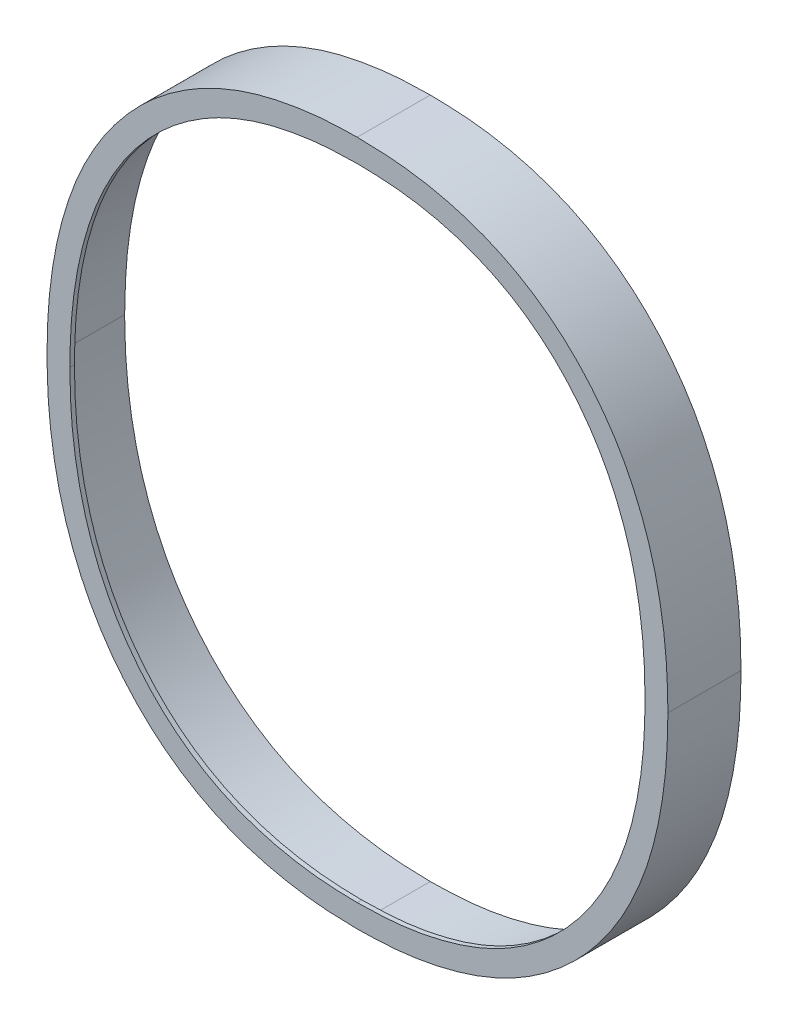
from build123d import *

# Parameters (mm, degrees)
BOSS_EXTRUDE1_DEPTH      = 1
BOSS_EXTRUDE1_DEPTH_BACK = 15
CUT_EXTRUDE1_DEPTH       = 16
CUT_EXTRUDE2_START       = -15
CUT_EXTRUDE2_DEPTH       = 15


# Read off the part's stored shape, not the designer's step: Cut-Extrude2
with BuildPart() as part:
    # Sketch1 → Boss-Extrude1 (new, two sides: drawn at the far end of the back side and taken through both)
    with BuildSketch(Plane.XY.offset(-BOSS_EXTRUDE1_DEPTH_BACK)):
        with BuildLine():
            add(Edge.make_bspline(
                [(2840.630960302, -1649.127227385), (2843.022054701, -1649.073911429), (2845.413070864, -1649.020141783), (2850.156339498, -1648.687812612), (2852.507701403, -1648.404088711), (2857.17163245, -1647.611682455), (2859.48438751, -1647.10407823), (2862.923008979, -1646.165738512), (2864.064167888, -1645.823683921), (2866.335213886, -1645.074209679), (2867.467482799, -1644.665783034), (2870.829320189, -1643.335733796), (2872.994098002, -1642.321572419), (2877.169582805, -1640.036364134), (2879.18055644, -1638.76576181), (2882.086669887, -1636.675874432), (2883.036830192, -1635.94832621), (2884.899039036, -1634.429685211), (2885.812127271, -1633.637143509), (2888.457161209, -1631.195244367), (2890.107907041, -1629.472639652), (2893.198544911, -1625.850164274), (2894.64077414, -1623.952258502), (2896.654506528, -1620.979620669), (2897.300714255, -1619.96572132), (2898.533473545, -1617.896167574), (2899.115012792, -1616.847075064), (2900.215965966, -1614.723363251), (2900.735766668, -1613.648902872), (2901.72322762, -1611.478558024), (2902.191625372, -1610.382976588), (2903.519171278, -1607.064327613), (2904.297122902, -1604.807897076), (2905.299697591, -1601.355720056), (2905.608102842, -1600.191887285), (2906.173438143, -1597.856878958), (2906.430422357, -1596.686400256), (2907.131635422, -1593.166887234), (2907.507657724, -1590.809953543), (2908.100006275, -1586.077590898), (2908.310571262, -1583.7014947), (2908.554703044, -1578.928803185), (2908.59792776, -1576.533326404), (2908.641066386, -1574.137839653)],
                knots=[0, 0, 0, 0, 0.0625, 0.0625, 0.125, 0.125, 0.1875, 0.1875, 0.21875, 0.21875, 0.25, 0.25, 0.3125, 0.3125, 0.375, 0.375, 0.40625, 0.40625, 0.4375, 0.4375, 0.5, 0.5, 0.5625, 0.5625, 0.59375, 0.59375, 0.625, 0.625, 0.65625, 0.65625, 0.6875, 0.6875, 0.75, 0.75, 0.78125, 0.78125, 0.8125, 0.8125, 0.875, 0.875, 0.9375, 0.9375, 1, 1, 1, 1], degree=3))
            add(Edge.make_bspline(
                [(2908.641066386, -1574.137839653), (2908.597684216, -1571.749685108), (2908.554151134, -1569.361554623), (2908.31304406, -1564.609851419), (2908.106187622, -1562.247758542), (2907.524039294, -1557.550425385), (2907.154061898, -1555.21433785), (2906.236986224, -1550.570400039), (2905.689366766, -1548.262632853), (2904.703405489, -1544.827212383), (2904.34705344, -1543.686487989), (2903.572771273, -1541.414856203), (2903.154120858, -1540.28122658), (2902.267440911, -1538.046905836), (2901.798929713, -1536.943851847), (2900.814107957, -1534.764531445), (2900.297125011, -1533.68864185), (2899.205963563, -1531.568916023), (2898.631499938, -1530.525239579), (2897.41827183, -1528.473921989), (2896.780463243, -1527.465745141), (2895.44723529, -1525.481677509), (2894.752132385, -1524.505609373), (2893.30693504, -1522.584291295), (2892.553742764, -1521.636672844), (2890.22908385, -1518.877244276), (2888.588507349, -1517.142626654), (2885.114342522, -1513.896581368), (2883.278682745, -1512.387549034), (2880.384407258, -1510.286798752), (2879.39655034, -1509.613258606), (2877.878323043, -1508.64508814), (2877.366138049, -1508.32942908), (2876.329059108, -1507.712807008), (2875.80430847, -1507.411984926), (2873.167951515, -1505.956972773), (2871.002655235, -1504.941729569), (2866.578185459, -1503.15969733), (2864.318863097, -1502.393302281), (2860.859823361, -1501.429119478), (2859.695172123, -1501.138526167), (2857.343889073, -1500.615513029), (2856.159625817, -1500.383667883), (2852.605335681, -1499.774802839), (2850.224545609, -1499.483953726), (2845.439214375, -1499.144885898), (2843.035197893, -1499.091307285), (2840.631161128, -1499.037935869)],
                knots=[0, 0, 0, 0, 0.0625, 0.0625, 0.125, 0.125, 0.1875, 0.1875, 0.25, 0.25, 0.28125, 0.28125, 0.3125, 0.3125, 0.34375, 0.34375, 0.375, 0.375, 0.40625, 0.40625, 0.4375, 0.4375, 0.46875, 0.46875, 0.5, 0.5, 0.5625, 0.5625, 0.625, 0.625, 0.65625, 0.65625, 0.671875, 0.671875, 0.6875, 0.6875, 0.75, 0.75, 0.8125, 0.8125, 0.84375, 0.84375, 0.875, 0.875, 0.9375, 0.9375, 1, 1, 1, 1], degree=3))
            add(Edge.make_bspline(
                [(2840.631161128, -1499.037935869), (2838.241286886, -1499.086479702), (2835.851511001, -1499.135588626), (2831.114536639, -1499.478424205), (2828.768733045, -1499.780164814), (2824.110163995, -1500.573458304), (2821.79605746, -1501.057306352), (2818.359665055, -1501.982825721), (2817.220189296, -1502.325736879), (2814.95350723, -1503.082050233), (2813.824899226, -1503.495790184), (2810.46632118, -1504.840695188), (2808.301126553, -1505.858894794), (2804.128188688, -1508.154516516), (2802.120056663, -1509.431298547), (2799.216615185, -1511.525524623), (2798.267222719, -1512.253928271), (2796.407727536, -1513.775420847), (2795.495891103, -1514.570885965), (2792.858468041, -1517.025000352), (2791.216352781, -1518.757197413), (2788.13473117, -1522.389237829), (2786.698381425, -1524.291693081), (2784.703140457, -1527.277173293), (2784.064062283, -1528.29406976), (2782.836667762, -1530.36897413), (2782.252855453, -1531.41854421), (2780.590140999, -1534.603230075), (2779.603593752, -1536.775794374), (2777.863858748, -1541.215546719), (2777.102717343, -1543.479509681), (2776.09739876, -1546.930759637), (2775.785661565, -1548.092923268), (2775.213545802, -1550.426597315), (2774.953853796, -1551.596485313), (2774.24713742, -1555.114522529), (2773.870079664, -1557.470768058), (2773.275316744, -1562.201698881), (2773.063582089, -1564.577075064), (2772.817178406, -1569.34831689), (2772.773136252, -1571.743097906), (2772.729177232, -1574.137888542)],
                knots=[0, 0, 0, 0, 0.0625, 0.0625, 0.125, 0.125, 0.1875, 0.1875, 0.21875, 0.21875, 0.25, 0.25, 0.3125, 0.3125, 0.375, 0.375, 0.40625, 0.40625, 0.4375, 0.4375, 0.5, 0.5, 0.5625, 0.5625, 0.59375, 0.59375, 0.625, 0.625, 0.6875, 0.6875, 0.75, 0.75, 0.78125, 0.78125, 0.8125, 0.8125, 0.875, 0.875, 0.9375, 0.9375, 1, 1, 1, 1], degree=3))
            add(Edge.make_bspline(
                [(2772.729177232, -1574.137888542), (2772.772747468, -1576.523465097), (2772.816487881, -1578.909014704), (2773.065140971, -1583.654591906), (2773.27963263, -1586.013102645), (2773.876430246, -1590.703550329), (2774.252288362, -1593.036508304), (2775.186969432, -1597.673451335), (2775.750706452, -1599.976658237), (2776.751690017, -1603.406864106), (2777.110690722, -1604.54625349), (2777.881132057, -1606.816728269), (2778.293463055, -1607.948209098), (2779.169744022, -1610.175841964), (2779.63488391, -1611.27486453), (2780.6231676, -1613.4411274), (2781.145626046, -1614.508743233), (2782.24387675, -1616.614751538), (2782.819383091, -1617.653300675), (2784.022462748, -1619.70186973), (2784.650661408, -1620.711547003), (2785.967013857, -1622.698050149), (2786.655677043, -1623.674596908), (2788.097802587, -1625.592184816), (2788.851733479, -1626.534716288), (2791.173370124, -1629.277267887), (2792.805870322, -1631.009770365), (2796.259699807, -1634.261161576), (2798.084604707, -1635.776005381), (2800.96899379, -1637.881940789), (2801.954858944, -1638.556314245), (2803.976750183, -1639.848316381), (2805.015971223, -1640.467446998), (2808.166723517, -1642.211822033), (2810.322166811, -1643.232142223), (2814.733666299, -1645.011650694), (2816.989789686, -1645.770664582), (2820.444871597, -1646.725178948), (2821.60833047, -1647.012815638), (2823.9566123, -1647.532640419), (2825.137304318, -1647.764036529), (2828.682421032, -1648.379348859), (2831.056658486, -1648.682255112), (2835.831400443, -1649.027729105), (2838.231167417, -1649.077606653), (2840.630960302, -1649.127227385)],
                knots=[0, 0, 0, 0, 0.0625, 0.0625, 0.125, 0.125, 0.1875, 0.1875, 0.25, 0.25, 0.28125, 0.28125, 0.3125, 0.3125, 0.34375, 0.34375, 0.375, 0.375, 0.40625, 0.40625, 0.4375, 0.4375, 0.46875, 0.46875, 0.5, 0.5, 0.5625, 0.5625, 0.625, 0.625, 0.65625, 0.65625, 0.6875, 0.6875, 0.75, 0.75, 0.8125, 0.8125, 0.84375, 0.84375, 0.875, 0.875, 0.9375, 0.9375, 1, 1, 1, 1], degree=3))
        make_face()
    extrude(amount=BOSS_EXTRUDE1_DEPTH + BOSS_EXTRUDE1_DEPTH_BACK)

    # 3DSketch1 → Cut-Extrude1 (cut)
    with BuildSketch(Plane(origin=(2903.64024848, -1574.138232494, 1), x_dir=(-0.9958790258074864, 0.09069159804927863, 0), z_dir=(0, 0, 1))):
        with BuildLine():
            add(Edge.make_bspline(
                [(0, 3e-09), (0.039471166, -0.360736712), (0.078959387, -0.721471667), (0.118578724, -1.082193102), (0.23929524, -2.174442295), (0.363305901, -3.266351786), (0.449232706, -3.997345354), (0.674001133, -5.817906957), (0.933864418, -7.634175942), (1.103425941, -8.719622817), (1.469558725, -10.863739332), (1.901296085, -12.995665319), (2.130480165, -14.047708576), (2.618529373, -16.144466206), (3.163855771, -18.226982814), (3.451389254, -19.263929837), (4.08142225, -21.409935766), (4.781520266, -23.534595226), (5.16504804, -24.630208377), (6.005663316, -26.886792415), (6.945427951, -29.104407137), (7.457907184, -30.242192347), (8.568329988, -32.570284213), (9.780516439, -34.847369375), (10.434904387, -36.007045616), (11.802820967, -38.288467666), (13.297521804, -40.48981886), (14.074919346, -41.568282249), (15.684544635, -43.674053074), (17.409312673, -45.686018074), (18.296666541, -46.664891033), (20.121820381, -48.570230767), (22.048764276, -50.373590103), (23.036444692, -51.245848597), (25.059213736, -52.925212385), (27.185887698, -54.47120835), (28.270858823, -55.209274286), (30.484845009, -56.61877634), (32.77858615, -57.894343291), (33.944580441, -58.496871404), (36.185345756, -59.566812452), (38.487507253, -60.497171835), (39.585112003, -60.90581288), (41.662883705, -61.61753787), (43.770781453, -62.230056464), (44.760726333, -62.494385342), (46.618195239, -62.947410507), (48.492378693, -63.325380219), (49.365404766, -63.484902006), (51.12268797, -63.773609409), (52.888806043, -64.000320328), (53.77668691, -64.099061015), (55.555514648, -64.267775606), (57.338806178, -64.381363567), (58.231300717, -64.423684953), (60.035182959, -64.478536365), (61.839759158, -64.468665362), (62.750922467, -64.449185637), (64.273581376, -64.395745273), (65.79450141, -64.313020594), (66.405435958, -64.276189258), (67.313217101, -64.217804415), (68.220793217, -64.156519061), (68.517713081, -64.136254225), (68.814624653, -64.115872097), (69.111534763, -64.095469272)],
                knots=[0, 0, 0, 0, 0, 0, 0.016988956, 0.016988956, 0.016988956, 0.051445443, 0.051445443, 0.051445443, 0.102863971, 0.102863971, 0.102863971, 0.153256586, 0.153256586, 0.153256586, 0.203620937, 0.203620937, 0.203620937, 0.257940032, 0.257940032, 0.257940032, 0.316317368, 0.316317368, 0.316317368, 0.378603204, 0.378603204, 0.378603204, 0.44077287, 0.44077287, 0.44077287, 0.502567106, 0.502567106, 0.502567106, 0.564181676, 0.564181676, 0.564181676, 0.62553548, 0.62553548, 0.62553548, 0.686901486, 0.686901486, 0.686901486, 0.741666033, 0.741666033, 0.741666033, 0.789610874, 0.789610874, 0.789610874, 0.831139688, 0.831139688, 0.831139688, 0.872948555, 0.872948555, 0.872948555, 0.914761928, 0.914761928, 0.914761928, 0.957414508, 0.957414508, 0.957414508, 0.98606715, 0.98606715, 0.98606715, 1, 1, 1, 1, 1, 1], degree=5))
            add(Edge.make_bspline(
                [(69.111534763, -64.095469272), (69.464795959, -64.056046836), (69.818054441, -64.01659478), (70.171295024, -63.976948012), (71.237710525, -63.856158877), (72.303686195, -63.730584888), (73.016053901, -63.642183331), (74.803994445, -63.403197447), (76.584072904, -63.107523026), (77.652310411, -62.908892888), (79.748209192, -62.47693317), (81.825516684, -61.964508698), (82.843503852, -61.693629134), (84.879641672, -61.113618933), (86.895634915, -60.465593421), (87.901899536, -60.120403483), (89.963564797, -59.361861814), (91.984245598, -58.49876508), (93.015028017, -58.026644307), (95.134402075, -56.990212436), (97.197849078, -55.845338513), (98.2527426, -55.22103097), (100.398858243, -53.865805889), (102.45700021, -52.380136056), (103.497199425, -51.578718457), (105.528070827, -49.913156064), (107.456436216, -48.129938572), (108.393359806, -47.209322264), (110.211145188, -45.309049555), (111.904770541, -43.29746268), (112.721759484, -42.264724379), (114.297882928, -40.147668914), (115.751618751, -37.945425034), (116.448730286, -36.821662241), (117.780501012, -34.533449742), (118.981348296, -32.173907465), (119.549667123, -30.976359007), (120.624298796, -28.54324866), (121.566727885, -26.056180214), (122.006324633, -24.796218433), (122.79367456, -22.3344449), (123.456863104, -19.837028936), (123.750495018, -18.621752465), (124.269465259, -16.259640307), (124.700517188, -13.880469463), (124.88792919, -12.727675374), (125.20893357, -10.496655706), (125.450241982, -8.255752095), (125.549224873, -7.174025404), (125.71467994, -5.011889683), (125.820773762, -2.846127305), (125.858336663, -1.764652259), (125.901946033, 0.421654307), (125.877823675, 2.608276307), (125.849756787, 3.71270895), (125.778771184, 5.554712046), (125.671394228, 7.394549207), (125.623970295, 8.131471897), (125.548771932, 9.231113597), (125.470201032, 10.33048871), (125.444019523, 10.693295603), (125.417703832, 11.056091889), (125.391370537, 11.418886784)],
                knots=[0, 0, 0, 0, 0, 0, 0.016656102, 0.016656102, 0.016656102, 0.050288639, 0.050288639, 0.050288639, 0.101175187, 0.101175187, 0.101175187, 0.150517731, 0.150517731, 0.150517731, 0.200338406, 0.200338406, 0.200338406, 0.253420111, 0.253420111, 0.253420111, 0.31079106, 0.31079106, 0.31079106, 0.372244336, 0.372244336, 0.372244336, 0.433716861, 0.433716861, 0.433716861, 0.495345784, 0.495345784, 0.495345784, 0.557249505, 0.557249505, 0.557249505, 0.619299769, 0.619299769, 0.619299769, 0.681771355, 0.681771355, 0.681771355, 0.740316743, 0.740316743, 0.740316743, 0.795022686, 0.795022686, 0.795022686, 0.845906438, 0.845906438, 0.845906438, 0.89659939, 0.89659939, 0.89659939, 0.948353752, 0.948353752, 0.948353752, 0.982955191, 0.982955191, 0.982955191, 1, 1, 1, 1, 1, 1], degree=5))
            add(Edge.make_bspline(
                [(125.391370537, 11.418886784), (125.351972413, 11.778627363), (125.31255637, 12.138366112), (125.273004362, 12.498090929), (125.152541029, 13.586632676), (125.028670283, 14.674825264), (124.94273935, 15.403086736), (124.717138475, 17.219427973), (124.454649898, 19.031221248), (124.282823311, 20.114945628), (123.911854817, 22.25276853), (123.474349723, 24.37792814), (123.242567577, 25.425245864), (122.748805401, 27.516075627), (122.198868289, 29.592933521), (121.908265996, 30.62861933), (121.269996615, 32.771582697), (120.555702973, 34.890570842), (120.164864028, 35.983424926), (119.313389186, 38.234484862), (118.378227428, 40.452757405), (117.870102087, 41.590848475), (116.766758553, 43.919290949), (115.547868045, 46.189799083), (114.888423802, 47.345844624), (113.515339718, 49.616104979), (112.028759706, 51.81415156), (111.259048747, 52.889631569), (109.6623359, 54.99436104), (107.945636636, 57.002704805), (107.059669419, 57.981250215), (105.238924494, 59.882495146), (103.31666562, 61.681106968), (102.333151939, 62.550317562), (100.317940232, 64.228099712), (98.203368487, 65.779759169), (97.123471936, 66.522167235), (94.92071519, 67.937948833), (92.633674408, 69.213079132), (91.471494632, 69.814231336), (89.239596114, 70.881592399), (86.948490243, 71.814698412), (85.857137329, 72.224668537), (83.791235176, 72.937869175), (81.693456614, 73.547321465), (80.708234883, 73.809395213), (78.856398952, 74.257948339), (76.987853527, 74.63015558), (76.115874914, 74.787288548), (74.356369094, 75.072474415), (72.588505665, 75.297679827), (71.697586261, 75.396595115), (69.915934177, 75.567071894), (68.129974495, 75.686877285), (67.237717346, 75.732727827), (65.437366381, 75.794384476), (63.635991259, 75.788533895), (62.727958022, 75.770417801), (61.213572304, 75.718205074), (59.701063274, 75.63484304), (59.095333607, 75.597660013), (58.194099073, 75.538495899), (57.293082695, 75.476327193), (56.997499512, 75.455708422), (56.701925213, 75.434967276), (56.406352502, 75.414204264)],
                knots=[0, 0, 0, 0, 0, 0, 0.016981499, 0.016981499, 0.016981499, 0.051390416, 0.051390416, 0.051390416, 0.102863586, 0.102863586, 0.102863586, 0.153183539, 0.153183539, 0.153183539, 0.203643357, 0.203643357, 0.203643357, 0.258084055, 0.258084055, 0.258084055, 0.316527726, 0.316527726, 0.316527726, 0.378925379, 0.378925379, 0.378925379, 0.440922694, 0.440922694, 0.440922694, 0.502797584, 0.502797584, 0.502797584, 0.564321508, 0.564321508, 0.564321508, 0.625734505, 0.625734505, 0.625734505, 0.687052523, 0.687052523, 0.687052523, 0.741691217, 0.741691217, 0.741691217, 0.78950336, 0.78950336, 0.78950336, 0.831060423, 0.831060423, 0.831060423, 0.873111044, 0.873111044, 0.873111044, 0.915018554, 0.915018554, 0.915018554, 0.957620094, 0.957620094, 0.957620094, 0.986096287, 0.986096287, 0.986096287, 1, 1, 1, 1, 1, 1], degree=5))
            add(Edge.make_bspline(
                [(56.406352502, 75.414204264), (56.052179402, 75.373968345), (55.698009245, 75.333703474), (55.343858356, 75.293249566), (54.269167858, 75.169418061), (53.19495541, 75.040896538), (52.475205375, 74.950634464), (50.68602141, 74.71090503), (48.9035511, 74.421321641), (47.84056848, 74.228878333), (45.745463345, 73.807345779), (43.669480815, 73.299701989), (42.647859886, 73.028169483), (40.612623604, 72.44449207), (38.601257189, 71.783492302), (37.600726953, 71.432779012), (35.537094906, 70.662423086), (33.508012318, 69.804086705), (32.466255549, 69.334047997), (30.334940853, 68.307285397), (28.26221231, 67.164463928), (27.207912501, 66.543018593), (25.063878922, 65.193617584), (23.006611575, 63.715698991), (21.967073619, 62.918825984), (19.935234119, 61.260460694), (18.006754171, 59.482975395), (17.068526053, 58.564205246), (15.245821498, 56.66725934), (13.543207702, 54.662020078), (12.720603247, 53.632227197), (11.133688607, 51.522324278), (9.669582027, 49.325897139), (8.967832618, 48.205366138), (7.626604733, 45.921998348), (6.417402079, 43.565778004), (5.845423977, 42.368963212), (4.767562072, 39.939995399), (3.828344158, 37.455011063), (3.390705788, 36.19796779), (2.621260829, 33.800249835), (1.955502351, 31.371934491), (1.665577811, 30.220968186), (1.166921947, 28.045539562), (0.759046563, 25.851856439), (0.586772021, 24.821171419), (0.298081204, 22.8928198), (0.066436851, 20.957030283), (-0.029214291, 20.057312321), (-0.19818318, 18.250351086), (-0.322979688, 16.439886211), (-0.374670382, 15.531288558), (-0.456482764, 13.717951354), (-0.496700215, 11.903127732), (-0.505888894, 10.998013404), (-0.501452188, 9.172435667), (-0.448556455, 7.347712508), (-0.41130745, 6.427969675), (-0.334272416, 4.891228422), (-0.237412423, 3.355842512), (-0.19605247, 2.739161259), (-0.1319638, 1.821322226), (-0.065796559, 0.903633503), (-0.043923983, 0.602418025), (-0.021968319, 0.301208555), (0, 3e-09)],
                knots=[0, 0, 0, 0, 0, 0, 0.016699956, 0.016699956, 0.016699956, 0.050682035, 0.050682035, 0.050682035, 0.101267325, 0.101267325, 0.101267325, 0.150766061, 0.150766061, 0.150766061, 0.20041316, 0.20041316, 0.20041316, 0.253920876, 0.253920876, 0.253920876, 0.311182341, 0.311182341, 0.311182341, 0.372472568, 0.372472568, 0.372472568, 0.433919226, 0.433919226, 0.433919226, 0.495595546, 0.495595546, 0.495595546, 0.557474119, 0.557474119, 0.557474119, 0.619549794, 0.619549794, 0.619549794, 0.68185874, 0.68185874, 0.68185874, 0.737425703, 0.737425703, 0.737425703, 0.786367053, 0.786367053, 0.786367053, 0.828747697, 0.828747697, 0.828747697, 0.871377512, 0.871377512, 0.871377512, 0.913775519, 0.913775519, 0.913775519, 0.956894109, 0.956894109, 0.956894109, 0.985850714, 0.985850714, 0.985850714, 1, 1, 1, 1, 1, 1], degree=5))
        make_face()
    extrude(amount=-CUT_EXTRUDE1_DEPTH, mode=Mode.SUBTRACT)

    # Cut-Extrude2 outline → Cut-Extrude2 (cut)
    with BuildSketch(Plane.XY.offset(CUT_EXTRUDE2_START)):
        with BuildLine():
            add(Edge.make_bspline(
                [(2773.729344847, -1574.137934574), (2773.736396202, -1573.7537964), (2773.743451521, -1573.369658274), (2773.750649414, -1572.985521857), (2773.772904504, -1571.842477925), (2773.798876672, -1570.699478549), (2773.819220306, -1569.940674561), (2773.881543402, -1568.042119074), (2773.981579075, -1566.144770124), (2774.056549708, -1565.006458788), (2774.237980181, -1562.744338634), (2774.488832668, -1560.488877409), (2774.630151016, -1559.368993935), (2774.945711669, -1557.126021152), (2775.322971029, -1554.892494387), (2775.528906039, -1553.774992995), (2775.994214187, -1551.458618407), (2776.54162105, -1549.160111956), (2776.847563626, -1547.972221773), (2777.527497578, -1545.517017472), (2778.298495928, -1543.088276913), (2778.724461957, -1541.837574658), (2779.664684795, -1539.267664455), (2780.732175786, -1536.747222057), (2781.318272438, -1535.458201534), (2782.557061045, -1532.914558151), (2783.930565998, -1530.440810075), (2784.650150689, -1529.224026621), (2786.155587463, -1526.831962478), (2787.793251827, -1524.52836986), (2788.644197664, -1523.40008315), (2790.408053657, -1521.193743212), (2792.294312219, -1519.090361959), (2793.267464619, -1518.067249139), (2795.273711982, -1516.08268591), (2797.40140493, -1514.228718028), (2798.493155313, -1513.335262102), (2800.730211317, -1511.615016302), (2803.065596969, -1510.030927038), (2804.257250527, -1509.274558552), (2806.550087359, -1507.917665621), (2808.920613818, -1506.701671103), (2810.051127315, -1506.160458821), (2812.190792066, -1505.205199207), (2814.373006201, -1504.354400347), (2815.396779698, -1503.981796213), (2817.316665593, -1503.3326937), (2819.262874349, -1502.767633111), (2820.167945208, -1502.52348046), (2821.989239912, -1502.067318977), (2823.82459774, -1501.673867904), (2824.746688088, -1501.491276983), (2826.592376119, -1501.153020477), (2828.446280665, -1500.861931566), (2829.373405754, -1500.730200504), (2831.235585653, -1500.496851194), (2833.10515713, -1500.33219742), (2834.043368689, -1500.265132331), (2835.605351214, -1500.176265284), (2837.168362601, -1500.120130625), (2837.79179498, -1500.101710928), (2838.733554438, -1500.078008237), (2839.675373034, -1500.057699683), (2839.993652808, -1500.051096786), (2840.311934893, -1500.044626499), (2840.630217066, -1500.038161321)],
                knots=[0, 0, 0, 0, 0, 0, 0.017001619, 0.017001619, 0.017001619, 0.050590799, 0.050590799, 0.050590799, 0.101057937, 0.101057937, 0.101057937, 0.15099382, 0.15099382, 0.15099382, 0.201261714, 0.201261714, 0.201261714, 0.25552171, 0.25552171, 0.25552171, 0.313949882, 0.313949882, 0.313949882, 0.376551626, 0.376551626, 0.376551626, 0.439043445, 0.439043445, 0.439043445, 0.501515712, 0.501515712, 0.501515712, 0.563923574, 0.563923574, 0.563923574, 0.626271905, 0.626271905, 0.626271905, 0.688652234, 0.688652234, 0.688652234, 0.744050369, 0.744050369, 0.744050369, 0.792233077, 0.792233077, 0.792233077, 0.833694922, 0.833694922, 0.833694922, 0.875281038, 0.875281038, 0.875281038, 0.916705555, 0.916705555, 0.916705555, 0.958313449, 0.958313449, 0.958313449, 0.985912577, 0.985912577, 0.985912577, 1, 1, 1, 1, 1, 1], degree=5))
            add(Edge.make_bspline(
                [(2840.63015014, -1648.126996882), (2840.246710749, -1648.119068313), (2839.863271395, -1648.111132643), (2839.479833161, -1648.102978663), (2838.34122368, -1648.077490042), (2837.202643209, -1648.046351539), (2836.447643386, -1648.020929922), (2834.551763479, -1647.939350453), (2832.658645363, -1647.798848413), (2831.520838912, -1647.692415307), (2829.263633859, -1647.436340439), (2827.018762027, -1647.089806265), (2825.906510235, -1646.896017508), (2823.683490305, -1646.465680415), (2821.477367447, -1645.954877855), (2820.376537692, -1645.67700254), (2818.108351101, -1645.052853532), (2815.871739179, -1644.321996774), (2814.723972479, -1643.915111365), (2812.35939211, -1643.009024335), (2810.045835645, -1641.977674583), (2808.860208051, -1641.408537855), (2806.440903083, -1640.160457759), (2804.101521603, -1638.767862925), (2802.915037188, -1638.01035166), (2800.591243987, -1636.422437999), (2798.371233989, -1634.692455307), (2797.288531557, -1633.793502423), (2795.179603291, -1631.930073704), (2793.188923105, -1629.941655946), (2792.223047344, -1628.918198994), (2790.349009446, -1626.815618686), (2788.593442797, -1624.613203849), (2787.746127001, -1623.486951148), (2786.116315429, -1621.187050383), (2784.622908178, -1618.796610181), (2783.90936167, -1617.580534031), (2782.546672305, -1615.110113328), (2781.311265522, -1612.574047544), (2780.725826016, -1611.289922401), (2779.682951707, -1608.837136415), (2778.761626368, -1606.336547411), (2778.353443302, -1605.150563283), (2777.633521588, -1602.914260917), (2776.991882267, -1600.655026382), (2776.710088116, -1599.597199403), (2776.21979159, -1597.62591686), (2775.791074957, -1595.640344781), (2775.605893899, -1594.722052427), (2775.259034471, -1592.878883196), (2774.957699149, -1591.027911632), (2774.817998828, -1590.099679132), (2774.560768812, -1588.243470717), (2774.345676585, -1586.381790742), (2774.249475511, -1585.451429368), (2774.079963968, -1583.580690437), (2773.960688796, -1581.706164748), (2773.91178112, -1580.764269122), (2773.845727101, -1579.192892832), (2773.800838071, -1577.621012376), (2773.785469232, -1576.991708931), (2773.765037619, -1576.043367932), (2773.746919867, -1575.094984774), (2773.741001037, -1574.77596915), (2773.735171457, -1574.456951899), (2773.729344847, -1574.137934574)],
                knots=[0, 0, 0, 0, 0, 0, 0.01699434, 0.01699434, 0.01699434, 0.050464525, 0.050464525, 0.050464525, 0.10107428, 0.10107428, 0.10107428, 0.151078707, 0.151078707, 0.151078707, 0.201360508, 0.201360508, 0.201360508, 0.255279001, 0.255279001, 0.255279001, 0.313484831, 0.313484831, 0.313484831, 0.375778905, 0.375778905, 0.375778905, 0.438055205, 0.438055205, 0.438055205, 0.500344697, 0.500344697, 0.500344697, 0.562729241, 0.562729241, 0.562729241, 0.625144495, 0.625144495, 0.625144495, 0.687626111, 0.687626111, 0.687626111, 0.743165355, 0.743165355, 0.743165355, 0.791659665, 0.791659665, 0.791659665, 0.833158872, 0.833158872, 0.833158872, 0.874746592, 0.874746592, 0.874746592, 0.916182673, 0.916182673, 0.916182673, 0.957968232, 0.957968232, 0.957968232, 0.985861562, 0.985861562, 0.985861562, 1, 1, 1, 1, 1, 1], degree=5))
            add(Edge.make_bspline(
                [(2907.640902833, -1574.137918291), (2907.633982144, -1574.52221988), (2907.627057559, -1574.906521425), (2907.619991067, -1575.290821344), (2907.598132592, -1576.434256292), (2907.572574226, -1577.577648871), (2907.552517541, -1578.336682925), (2907.490969605, -1580.235235652), (2907.391851363, -1582.132594221), (2907.317489188, -1583.270689769), (2907.137140165, -1585.534888583), (2906.887307738, -1587.792508249), (2906.746310506, -1588.914702218), (2906.431588678, -1591.160237823), (2906.055115567, -1593.396183179), (2905.850145487, -1594.513998694), (2905.388543801, -1596.831225483), (2904.849937361, -1599.132271875), (2904.548172874, -1600.321206261), (2903.872884395, -1602.774950141), (2903.089327882, -1605.196773421), (2902.655267905, -1606.442261513), (2901.699403981, -1609.003029141), (2900.630776347, -1611.519111628), (2900.045924322, -1612.807030759), (2898.809707458, -1615.349321358), (2897.432512097, -1617.819040665), (2896.709720023, -1619.033653668), (2895.195440033, -1621.422136036), (2893.54792773, -1623.720441363), (2892.691219495, -1624.846484204), (2890.916567787, -1627.046167753), (2889.019179383, -1629.141457382), (2888.04134062, -1630.159954872), (2886.027303218, -1632.135921642), (2883.895769162, -1633.984765913), (2882.802843881, -1634.875955407), (2880.566073683, -1636.589892515), (2878.230222488, -1638.166142052), (2877.039561774, -1638.917766203), (2874.694745889, -1640.298151433), (2872.26987909, -1641.533037273), (2871.082616139, -1642.094858108), (2868.761206495, -1643.112929076), (2866.38865619, -1644.001875054), (2865.234756316, -1644.401549203), (2862.999039861, -1645.117030118), (2860.735020876, -1645.735490231), (2859.642851416, -1646.010290518), (2857.454859058, -1646.51521936), (2855.249054496, -1646.935935099), (2854.145591423, -1647.124175599), (2851.921711287, -1647.458120941), (2849.68609153, -1647.700920101), (2848.560939741, -1647.801236352), (2846.681950137, -1647.934716788), (2844.800642029, -1648.015578644), (2844.047162249, -1648.041544149), (2842.911615052, -1648.074062889), (2841.776007125, -1648.101226476), (2841.394056395, -1648.109956472), (2841.012103323, -1648.118480047), (2840.63015014, -1648.126996882)],
                knots=[0, 0, 0, 0, 0, 0, 0.017007419, 0.017007419, 0.017007419, 0.050603808, 0.050603808, 0.050603808, 0.101055994, 0.101055994, 0.101055994, 0.151086847, 0.151086847, 0.151086847, 0.201359639, 0.201359639, 0.201359639, 0.255610555, 0.255610555, 0.255610555, 0.313929176, 0.313929176, 0.313929176, 0.376465915, 0.376465915, 0.376465915, 0.438936029, 0.438936029, 0.438936029, 0.501477502, 0.501477502, 0.501477502, 0.563878167, 0.563878167, 0.563878167, 0.626200499, 0.626200499, 0.626200499, 0.688427266, 0.688427266, 0.688427266, 0.746470362, 0.746470362, 0.746470362, 0.800466726, 0.800466726, 0.800466726, 0.850274506, 0.850274506, 0.850274506, 0.899779793, 0.899779793, 0.899779793, 0.949737955, 0.949737955, 0.949737955, 0.983095052, 0.983095052, 0.983095052, 1, 1, 1, 1, 1, 1], degree=5))
            add(Edge.make_bspline(
                [(2840.630217066, -1500.038161321), (2841.01456466, -1500.046694272), (2841.398912145, -1500.055233969), (2841.783257547, -1500.063983686), (2842.927262646, -1500.091257715), (2844.071213591, -1500.123994448), (2844.830693645, -1500.150249407), (2846.731875207, -1500.232584251), (2848.630576135, -1500.369675746), (2849.769455347, -1500.472897222), (2852.029609025, -1500.721899705), (2854.277813031, -1501.062305475), (2855.391974444, -1501.253792403), (2857.616593521, -1501.681466456), (2859.822942187, -1502.195902221), (2860.922756958, -1502.476270223), (2863.19363083, -1503.107428923), (2865.432792159, -1503.84383052), (2866.584420931, -1504.253775933), (2868.956779022, -1505.16392591), (2871.280760069, -1506.193897484), (2872.471587881, -1506.761503494), (2874.900322488, -1508.0065201), (2877.246568791, -1509.40102838), (2878.436118888, -1510.159606605), (2880.766929103, -1511.748214991), (2882.999069193, -1513.47267575), (2884.088101045, -1514.368248061), (2886.209811203, -1516.226921457), (2888.208142511, -1518.217383748), (2889.177377748, -1519.243413053), (2891.056947858, -1521.351923303), (2892.817650993, -1523.559731504), (2893.667825589, -1524.688304026), (2895.30593834, -1526.993302157), (2896.812716561, -1529.386758229), (2897.532987652, -1530.605242906), (2898.90431636, -1533.080923496), (2900.134113114, -1535.628994861), (2900.715301657, -1536.918953962), (2901.776386984, -1539.437987783), (2902.724632797, -1542.001333701), (2903.154894156, -1543.247524001), (2903.929770354, -1545.665806246), (2904.597223038, -1548.115411488), (2904.894847748, -1549.299753071), (2905.424724909, -1551.58588904), (2905.879148252, -1553.887744475), (2906.080432242, -1554.995023341), (2906.450500891, -1557.212144434), (2906.759453214, -1559.438674108), (2906.897922802, -1560.55252707), (2907.143424211, -1562.795588274), (2907.320540901, -1565.045036828), (2907.393655307, -1566.176833834), (2907.49130904, -1568.064956924), (2907.552372913, -1569.954232266), (2907.572367734, -1570.710334548), (2907.597940816, -1571.849537081), (2907.61988075, -1572.988783176), (2907.626982368, -1573.371827079), (2907.633944522, -1573.754872654), (2907.640902833, -1574.137918291)],
                knots=[0, 0, 0, 0, 0, 0, 0.016999235, 0.016999235, 0.016999235, 0.050598808, 0.050598808, 0.050598808, 0.101138044, 0.101138044, 0.101138044, 0.151100149, 0.151100149, 0.151100149, 0.201257194, 0.201257194, 0.201257194, 0.255272339, 0.255272339, 0.255272339, 0.313533354, 0.313533354, 0.313533354, 0.375837443, 0.375837443, 0.375837443, 0.4381044, 0.4381044, 0.4381044, 0.50043965, 0.50043965, 0.50043965, 0.562858184, 0.562858184, 0.562858184, 0.625376584, 0.625376584, 0.625376584, 0.687885425, 0.687885425, 0.687885425, 0.746138284, 0.746138284, 0.746138284, 0.800111241, 0.800111241, 0.800111241, 0.849862337, 0.849862337, 0.849862337, 0.899479324, 0.899479324, 0.899479324, 0.949615942, 0.949615942, 0.949615942, 0.983059727, 0.983059727, 0.983059727, 1, 1, 1, 1, 1, 1], degree=5))
        make_face()
        with BuildLine():
            add(Edge.make_bspline(
                [(2777.730015454, -1574.138118557), (2777.736625772, -1574.49994974), (2777.7432541, -1574.861780719), (2777.750019096, -1575.223610154), (2777.771264412, -1576.318591061), (2777.795934766, -1577.413533271), (2777.815464383, -1578.14658681), (2777.875408673, -1579.975903056), (2777.972501114, -1581.804035486), (2778.045334912, -1582.898877094), (2778.22089208, -1585.061533809), (2778.463860105, -1587.217613726), (2778.599704165, -1588.281636174), (2778.901810867, -1590.408629763), (2779.261128142, -1592.526803654), (2779.456604869, -1593.584576615), (2779.897895186, -1595.776594556), (2780.417070821, -1597.951630837), (2780.707186446, -1599.075427106), (2781.351000158, -1601.394432096), (2782.081129458, -1603.68837451), (2782.483945529, -1604.867858235), (2783.371572044, -1607.286769246), (2784.379523524, -1609.658463802), (2784.931406597, -1610.869551362), (2786.092938697, -1613.254983222), (2787.374048194, -1615.578792027), (2788.043050194, -1616.719646327), (2789.44230175, -1618.960510702), (2790.969786635, -1621.116268334), (2791.763356956, -1622.171130966), (2793.404171698, -1624.229667184), (2795.155390012, -1626.195199701), (2796.05602056, -1627.150024729), (2797.910766888, -1629.003655551), (2799.875902062, -1630.740694551), (2800.884018212, -1631.577980716), (2802.949297959, -1633.187699444), (2805.111270301, -1634.664990348), (2806.214141309, -1635.36906516), (2808.340041551, -1636.634442099), (2810.537080958, -1637.771486859), (2811.58675559, -1638.278744047), (2813.579462907, -1639.176365571), (2815.613324376, -1639.973557214), (2816.570718147, -1640.323902297), (2818.37424271, -1640.938552907), (2820.201331838, -1641.478687662), (2821.05546641, -1641.714254222), (2822.78185739, -1642.157837241), (2824.522011261, -1642.542444947), (2825.400288423, -1642.721751512), (2827.159137553, -1643.053106634), (2828.926871999, -1643.334389849), (2829.811293921, -1643.460971669), (2831.598633945, -1643.685650938), (2833.393116246, -1643.843194056), (2834.299050479, -1643.907503603), (2835.811930708, -1643.992848104), (2837.325766964, -1644.047001463), (2837.932372622, -1644.064906259), (2838.83525888, -1644.087720359), (2839.738200371, -1644.107522463), (2840.034435414, -1644.113795573), (2840.330672706, -1644.119946006), (2840.6269104, -1644.12607452)],
                knots=[0, 0, 0, 0, 0, 0, 0.016981499, 0.016981499, 0.016981499, 0.051390416, 0.051390416, 0.051390416, 0.102863586, 0.102863586, 0.102863586, 0.153183539, 0.153183539, 0.153183539, 0.203643357, 0.203643357, 0.203643357, 0.258084055, 0.258084055, 0.258084055, 0.316527726, 0.316527726, 0.316527726, 0.378925379, 0.378925379, 0.378925379, 0.440922694, 0.440922694, 0.440922694, 0.502797584, 0.502797584, 0.502797584, 0.564321508, 0.564321508, 0.564321508, 0.625734505, 0.625734505, 0.625734505, 0.687052523, 0.687052523, 0.687052523, 0.741691217, 0.741691217, 0.741691217, 0.78950336, 0.78950336, 0.78950336, 0.831060423, 0.831060423, 0.831060423, 0.873111044, 0.873111044, 0.873111044, 0.915018554, 0.915018554, 0.915018554, 0.957620094, 0.957620094, 0.957620094, 0.986096287, 0.986096287, 0.986096287, 1, 1, 1, 1, 1, 1], degree=5))
            add(Edge.make_bspline(
                [(2840.626441112, -1504.039063465), (2840.271060404, -1504.04628562), (2839.915679722, -1504.053537519), (2839.560299205, -1504.06098495), (2838.487323815, -1504.08456139), (2837.414352497, -1504.112942855), (2836.696903162, -1504.136374346), (2834.894656663, -1504.21222419), (2833.095098675, -1504.345241985), (2832.013249264, -1504.446173406), (2829.88681251, -1504.686272619), (2827.771592954, -1505.008191067), (2826.733234384, -1505.18563146), (2824.652885384, -1505.578590862), (2822.586429528, -1506.041112229), (2821.55300587, -1506.293619902), (2819.431043322, -1506.862059923), (2817.340414073, -1507.538341086), (2816.271062094, -1507.915032957), (2814.066426259, -1508.754984299), (2811.907652222, -1509.708002919), (2810.800486441, -1510.234067728), (2808.540307356, -1511.389073304), (2806.355909169, -1512.681964546), (2805.247314745, -1513.385742195), (2803.073759996, -1514.860257875), (2800.991618507, -1516.461240235), (2799.975063791, -1517.293091609), (2797.992430686, -1519.020675483), (2796.123350692, -1520.87037507), (2795.216067852, -1521.824763451), (2793.45444043, -1523.790153431), (2791.806970397, -1525.851480296), (2791.010815797, -1526.907389932), (2789.477011616, -1529.065392351), (2788.067122333, -1531.306304256), (2787.392537949, -1532.447375905), (2786.101672141, -1534.772999403), (2784.937570566, -1537.164348305), (2784.385517437, -1538.379250084), (2783.378149983, -1540.759472689), (2782.491199777, -1543.186451237), (2782.088562547, -1544.370089637), (2781.357507243, -1546.675401352), (2780.712460862, -1549.005674905), (2780.421272442, -1550.136721666), (2779.899256174, -1552.329434959), (2779.455711057, -1554.539219219), (2779.25903255, -1555.607511225), (2778.898171776, -1557.745731456), (2778.596098712, -1559.892946966), (2778.460609907, -1560.966558641), (2778.218900614, -1563.13990049), (2778.044615321, -1565.319699173), (2777.972403785, -1566.422125908), (2777.876042654, -1568.262975956), (2777.816119339, -1570.104969382), (2777.796515143, -1570.843156185), (2777.771675353, -1571.94508615), (2777.750218379, -1573.047056487), (2777.743388457, -1573.410742705), (2777.736693127, -1573.774430529), (2777.730015454, -1574.138118557)],
                knots=[0, 0, 0, 0, 0, 0, 0.016656102, 0.016656102, 0.016656102, 0.050288639, 0.050288639, 0.050288639, 0.101175187, 0.101175187, 0.101175187, 0.150517731, 0.150517731, 0.150517731, 0.200338406, 0.200338406, 0.200338406, 0.253420111, 0.253420111, 0.253420111, 0.31079106, 0.31079106, 0.31079106, 0.372244336, 0.372244336, 0.372244336, 0.433716861, 0.433716861, 0.433716861, 0.495345784, 0.495345784, 0.495345784, 0.557249505, 0.557249505, 0.557249505, 0.619299769, 0.619299769, 0.619299769, 0.681771355, 0.681771355, 0.681771355, 0.740316743, 0.740316743, 0.740316743, 0.795022686, 0.795022686, 0.795022686, 0.845906438, 0.845906438, 0.845906438, 0.89659939, 0.89659939, 0.89659939, 0.948353752, 0.948353752, 0.948353752, 0.982955191, 0.982955191, 0.982955191, 1, 1, 1, 1, 1, 1], degree=5))
            add(Edge.make_bspline(
                [(2903.64024848, -1574.138232497), (2903.633655762, -1573.775402666), (2903.627045901, -1573.412573039), (2903.620304238, -1573.049744987), (2903.599143016, -1571.951048952), (2903.574670416, -1570.852392466), (2903.555392688, -1570.116618464), (2903.496660167, -1568.283174741), (2903.402588109, -1566.450823137), (2903.332166256, -1565.354471555), (2903.161995649, -1563.185985722), (2902.925385242, -1561.023690396), (2902.792557108, -1559.955197512), (2902.496677438, -1557.822818603), (2902.142465075, -1555.69942747), (2901.950158893, -1554.640676807), (2901.517346954, -1552.446375815), (2901.012822785, -1550.266979013), (2900.730238427, -1549.141098109), (2900.097740518, -1546.817576653), (2899.362967651, -1544.523871907), (2898.955787891, -1543.34429792), (2898.061079482, -1540.925094042), (2897.060400913, -1538.547457563), (2896.513882572, -1537.333212829), (2895.358508953, -1534.937133919), (2894.069611797, -1532.60929763), (2893.393225458, -1531.464775135), (2891.981209114, -1529.221702648), (2890.446017122, -1527.061606934), (2889.65109557, -1526.006292345), (2888.006261447, -1523.943278348), (2886.250807978, -1521.972592988), (2885.346304285, -1521.014354734), (2883.484175205, -1519.158463404), (2881.506474056, -1517.425966988), (2880.492910448, -1516.592544837), (2878.415878036, -1514.98806136), (2876.247272548, -1513.509727938), (2875.140727528, -1512.803936942), (2873.006231012, -1511.535186506), (2870.797932442, -1510.399874405), (2869.741911202, -1509.89337383), (2867.73724942, -1508.996145405), (2865.693588555, -1508.194982368), (2864.73169562, -1507.8419631), (2862.922966872, -1507.222348016), (2861.090785557, -1506.675963215), (2860.235824487, -1506.437922684), (2858.511966338, -1505.991034215), (2856.773687168, -1505.605085495), (2855.898420186, -1505.426228381), (2854.142223947, -1505.096884329), (2852.376582788, -1504.822034902), (2851.491604391, -1504.698946165), (2849.700130463, -1504.480723831), (2847.902095659, -1504.326894257), (2846.992920583, -1504.26365885), (2845.47168992, -1504.178786618), (2843.949535125, -1504.123235722), (2843.337777929, -1504.104508646), (2842.428442715, -1504.080324765), (2841.519048629, -1504.059048034), (2841.221514515, -1504.052301223), (2840.923978019, -1504.045671972), (2840.626441112, -1504.039063465)],
                knots=[0, 0, 0, 0, 0, 0, 0.016988956, 0.016988956, 0.016988956, 0.051445443, 0.051445443, 0.051445443, 0.102863971, 0.102863971, 0.102863971, 0.153256586, 0.153256586, 0.153256586, 0.203620937, 0.203620937, 0.203620937, 0.257940032, 0.257940032, 0.257940032, 0.316317368, 0.316317368, 0.316317368, 0.378603204, 0.378603204, 0.378603204, 0.44077287, 0.44077287, 0.44077287, 0.502567106, 0.502567106, 0.502567106, 0.564181676, 0.564181676, 0.564181676, 0.62553548, 0.62553548, 0.62553548, 0.686901486, 0.686901486, 0.686901486, 0.741666033, 0.741666033, 0.741666033, 0.789610874, 0.789610874, 0.789610874, 0.831139688, 0.831139688, 0.831139688, 0.872948555, 0.872948555, 0.872948555, 0.914761928, 0.914761928, 0.914761928, 0.957414508, 0.957414508, 0.957414508, 0.98606715, 0.98606715, 0.98606715, 1, 1, 1, 1, 1, 1], degree=5))
            add(Edge.make_bspline(
                [(2840.6269104, -1644.12607452), (2840.983273021, -1644.118124936), (2841.339635338, -1644.110146253), (2841.69599561, -1644.101977565), (2842.777487814, -1644.076121765), (2843.858929282, -1644.045551919), (2844.583899257, -1644.020937094), (2846.387451486, -1643.944459532), (2848.188839063, -1643.81772459), (2849.26489415, -1643.722477928), (2851.389594872, -1643.492690932), (2853.503061358, -1643.175413302), (2854.54509793, -1642.997652208), (2856.624881694, -1642.600958946), (2858.687906445, -1642.125097175), (2859.71612027, -1641.866568851), (2861.841112953, -1641.286541631), (2863.939677642, -1640.615763174), (2865.019769919, -1640.24214007), (2867.235420264, -1639.412901067), (2869.403251452, -1638.4627682), (2870.509566389, -1637.93949996), (2872.767143795, -1636.790105629), (2874.949967995, -1635.504854364), (2876.057491728, -1634.805542609), (2878.231357868, -1633.33828217), (2880.313093583, -1631.743018771), (2881.33078002, -1630.913124257), (2883.318010312, -1629.189299605), (2885.195466033, -1627.346736648), (2886.108074119, -1626.39579083), (2887.879799592, -1624.438502591), (2889.537070113, -1622.383909037), (2890.337550379, -1621.331638491), (2891.880333372, -1619.179318501), (2893.298242322, -1616.942472601), (2893.976404363, -1615.80246346), (2895.270111399, -1613.481258379), (2896.430826021, -1611.091693773), (2896.980664158, -1609.879520866), (2897.964391127, -1607.561466038), (2898.84763383, -1605.203536419), (2899.240746572, -1604.083606936), (2899.934640587, -1601.962367094), (2900.539783755, -1599.814714953), (2900.80482283, -1598.803901214), (2901.267209249, -1596.909678113), (2901.673458847, -1595.002874131), (2901.850312672, -1594.115538639), (2902.182461447, -1592.331347903), (2902.470937625, -1590.539661902), (2902.604817476, -1589.639496468), (2902.85074716, -1587.841051675), (2903.05538813, -1586.03735428), (2903.146625207, -1585.13680324), (2903.307771348, -1583.31834629), (2903.420580656, -1581.49634557), (2903.4668981, -1580.577014801), (2903.529550045, -1579.039619989), (2903.572335811, -1577.501776978), (2903.587074111, -1576.883886051), (2903.606489837, -1575.964017105), (2903.623821927, -1575.044109341), (2903.6293572, -1574.742151505), (2903.634809182, -1574.440192118), (2903.64024848, -1574.138232497)],
                knots=[0, 0, 0, 0, 0, 0, 0.016699956, 0.016699956, 0.016699956, 0.050682035, 0.050682035, 0.050682035, 0.101267325, 0.101267325, 0.101267325, 0.150766061, 0.150766061, 0.150766061, 0.20041316, 0.20041316, 0.20041316, 0.253920876, 0.253920876, 0.253920876, 0.311182341, 0.311182341, 0.311182341, 0.372472568, 0.372472568, 0.372472568, 0.433919226, 0.433919226, 0.433919226, 0.495595546, 0.495595546, 0.495595546, 0.557474119, 0.557474119, 0.557474119, 0.619549794, 0.619549794, 0.619549794, 0.68185874, 0.68185874, 0.68185874, 0.737425703, 0.737425703, 0.737425703, 0.786367053, 0.786367053, 0.786367053, 0.828747697, 0.828747697, 0.828747697, 0.871377512, 0.871377512, 0.871377512, 0.913775519, 0.913775519, 0.913775519, 0.956894109, 0.956894109, 0.956894109, 0.985850714, 0.985850714, 0.985850714, 1, 1, 1, 1, 1, 1], degree=5))
        make_face(mode=Mode.SUBTRACT)
    extrude(amount=CUT_EXTRUDE2_DEPTH, mode=Mode.SUBTRACT)


solid = part.part
